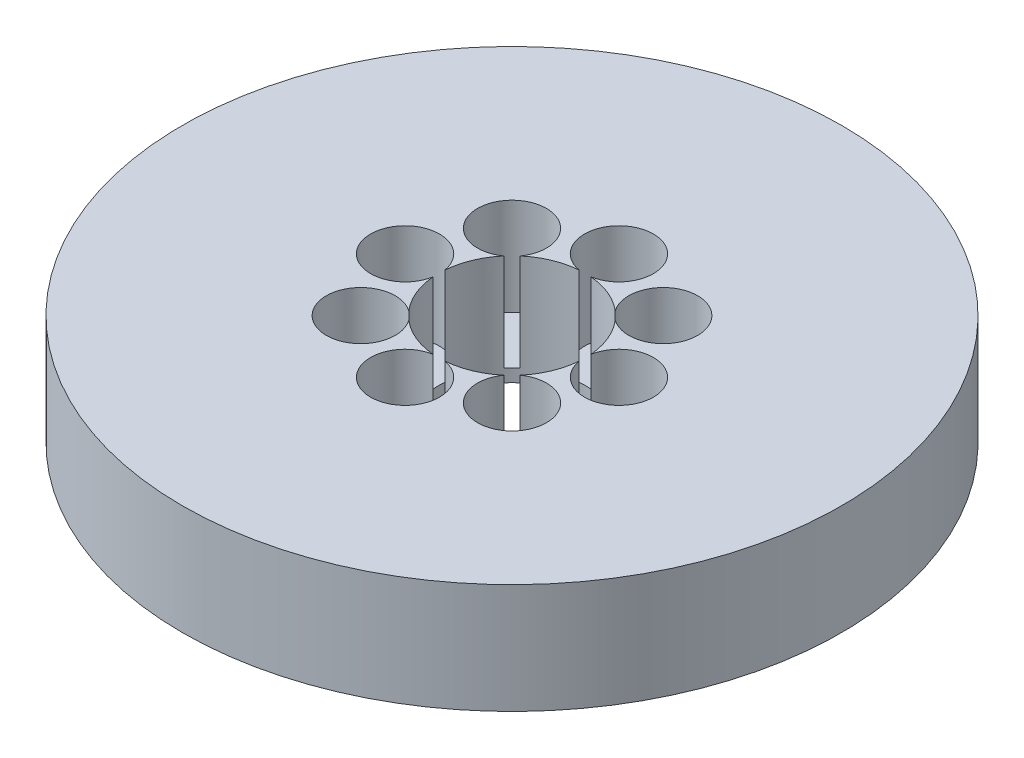
from build123d import *

# Parameters (mm, degrees)
SKETCH1_R           = 90
BOSS_EXTRUDE1_DEPTH = 30
SKETCH2_R           = 20
CUT_EXTRUDE1_DEPTH  = 131.766968306
SKETCH3_R           = 9.403734952
CUT_EXTRUDE2_DEPTH  = 26.527090062
CIRPATTERN1_COUNT   = 8


with BuildPart() as part:
    # Sketch1 → Boss-Extrude1 (new body)
    with BuildSketch(Plane(origin=(0, 0, 0), x_dir=(1, 0, 0), z_dir=(0, 1, 0))):
        Circle(SKETCH1_R)
    extrude(amount=BOSS_EXTRUDE1_DEPTH)

    # Sketch2 → Cut-Extrude1 (cut, through all)
    with BuildSketch(Plane(origin=(0, 0, 0), x_dir=(1, 0, 0), z_dir=(0, 1, 0))):
        Circle(SKETCH2_R)
    extrude(amount=CUT_EXTRUDE1_DEPTH, mode=Mode.SUBTRACT)

    # Sketch3 → Cut-Extrude2 (cut)
    with BuildSketch(Plane(origin=(0, 30, 0), x_dir=(1, 0, 0), z_dir=(0, 1, 0))):
        with Locations((-29.205054279, 0)):
            Circle(SKETCH3_R)
    cut_extrude2 = extrude(amount=-CUT_EXTRUDE2_DEPTH, mode=Mode.SUBTRACT)

    # CirPattern1: Cut-Extrude2 ×8 about axis
    cirpattern1_axis = Axis((0, 0, 0), (0, 1, 0))
    for i in range(1, CIRPATTERN1_COUNT):
        add(cut_extrude2.rotate(cirpattern1_axis, i * 360 / CIRPATTERN1_COUNT), mode=Mode.SUBTRACT)


solid = part.part
